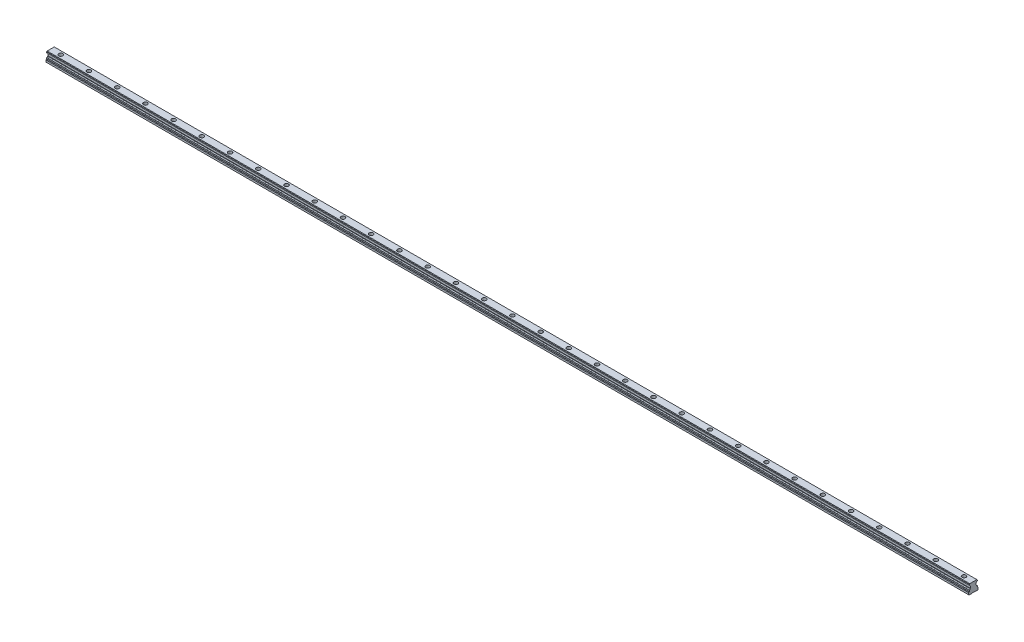
from build123d import *

# Parameters (mm, degrees)
BOSS_EXTRUDE5_DEPTH = 1961
SKETCH8_R           = 4.25
CUT_EXTRUDE1_DEPTH  = 9
SKETCH9_R           = 3
CUT_EXTRUDE2_DEPTH  = 2020.556372078
LPATTERN1_COUNT     = 35
LPATTERN1_PITCH     = 60


with BuildPart() as part:
    # Sketch7 → Boss-Extrude5 (new body)
    with BuildSketch(Plane(origin=(58.5, 0, 0), x_dir=(0, 0, -1), z_dir=(1, 0, 0))):
        with BuildLine():
            Line((-7.709038211, 8.883084864), (-8.5, 8.601077183))
            Line((-8.5, 8.601077183), (-8.5, 6.104700538))
            ThreePointArc((-8.5, 6.104700538), (-8.566987298, 5.854700538), (-8.75, 5.671687836))
            Line((-8.75, 5.671687836), (-10, 4.95))
            Line((-10, 4.95), (-10, 1))
            Line((-10, 1), (-9, 0))
            Line((-9, 0), (-4, 0))
            Line((-4, 0), (-3.5, 0.5))
            Line((-3.5, 0.5), (3.5, 0.5))
            Line((3.5, 0.5), (4, 0))
            Line((4, 0), (9, 0))
            Line((9, 0), (10, 1))
            Line((10, 1), (10, 4.95))
            Line((10, 4.95), (8.75, 5.671687836))
            ThreePointArc((8.75, 5.671687836), (8.566987298, 5.854700538), (8.5, 6.104700538))
            Line((8.5, 6.104700538), (8.5, 8.46691323))
            Line((8.5, 8.46691323), (8.084678947, 8.882234283))
            ThreePointArc((8.084678947, 8.882234283), (6.941822875, 9.249266637), (6.503340774, 10.366659226))
            Line((6.503340774, 10.366659226), (6, 10.87))
            Line((6, 10.87), (6, 14.93))
            Line((6, 14.93), (6.503340774, 15.433340774))
            ThreePointArc((6.503340774, 15.433340774), (6.813545517, 16.412959034), (7.709038211, 16.916915136))
            Line((7.709038211, 16.916915136), (8.5, 17.198922817))
            Line((8.5, 17.198922817), (8.5, 19.3))
            Line((8.5, 19.3), (7.5, 20.3))
            Line((7.5, 20.3), (-7.5, 20.3))
            Line((-7.5, 20.3), (-8.5, 19.3))
            Line((-8.5, 19.3), (-8.5, 17.33308677))
            Line((-8.5, 17.33308677), (-8.084678947, 16.917765717))
            ThreePointArc((-8.084678947, 16.917765717), (-6.941822875, 16.550733363), (-6.503340774, 15.433340774))
            Line((-6.503340774, 15.433340774), (-6, 14.93))
            Line((-6, 14.93), (-6, 10.87))
            Line((-6, 10.87), (-6.503340774, 10.366659226))
            ThreePointArc((-6.503340774, 10.366659226), (-6.813545517, 9.387040966), (-7.709038211, 8.883084864))
        make_face()
    extrude(amount=BOSS_EXTRUDE5_DEPTH)

    # Sketch8 → Cut-Extrude1 (cut)
    with BuildSketch(Plane(origin=(0, 20.3, 0), x_dir=(1, 0, 0), z_dir=(0, 1, 0))):
        with Locations((1999.777933547, 0)):
            Circle(SKETCH8_R)
    cut_extrude1 = extrude(amount=-CUT_EXTRUDE1_DEPTH, mode=Mode.SUBTRACT)

    # Sketch9 → Cut-Extrude2 (cut, through all)
    with BuildSketch(Plane(origin=(0, 11.3, 0), x_dir=(1, 0, 0), z_dir=(0, 1, 0))):
        with Locations((1999.777933547, 0)):
            Circle(SKETCH9_R)
    cut_extrude2 = extrude(amount=-CUT_EXTRUDE2_DEPTH, mode=Mode.SUBTRACT)

    # LPattern1: Cut-Extrude1, Cut-Extrude2 ×35
    with Locations(*[(-i * LPATTERN1_PITCH, 0, 0) for i in range(1, LPATTERN1_COUNT)]):
        add(cut_extrude1, mode=Mode.SUBTRACT)
        add(cut_extrude2, mode=Mode.SUBTRACT)


solid = part.part
